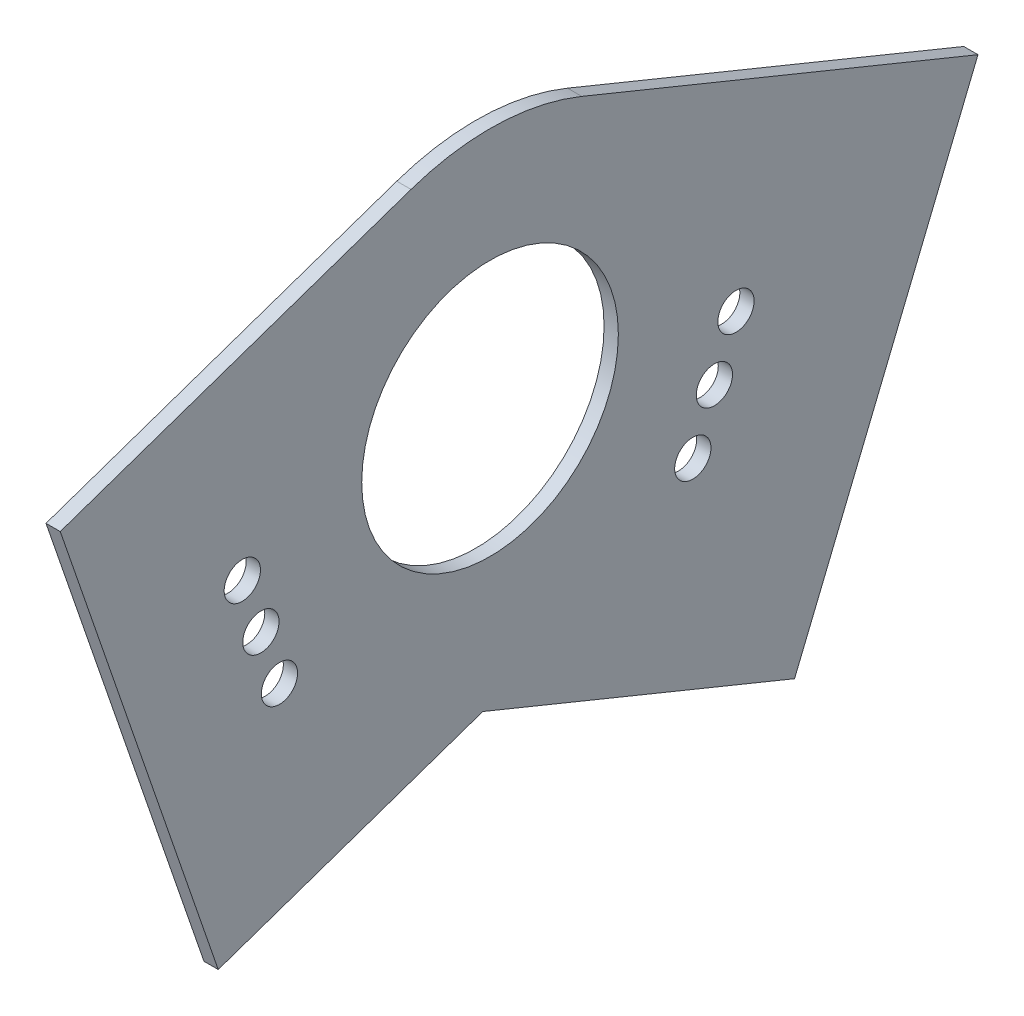
from build123d import *

# Parameters (mm, degrees)
SKETCH1_R           = 2.0193
SKETCH1_R_2         = 14.2875
BOSS_EXTRUDE1_DEPTH = 1.5875


with BuildPart() as part:
    # Sketch1 → Boss-Extrude1 (new body)
    with BuildSketch(Plane(origin=(0, 0, 0), x_dir=(0, 0, -1), z_dir=(1, 0, 0))):
        with BuildLine():
            Line((288.401681083, 160.383356591), (249.345231223, 146.9200509))
            Line((249.345231223, 146.9200509), (266.935398847, 95.891758474))
            Line((266.935398847, 95.891758474), (296.387053498, 106.044156633))
            Line((296.387053498, 106.044156633), (331.100032982, 91.851270852))
            Line((331.100032982, 91.851270852), (351.527026912, 141.811640586))
            Line((351.527026912, 141.811640586), (307.41026186, 159.849395245))
            ThreePointArc((307.41026186, 159.849395245), (297.954559489, 161.846069046), (288.401681083, 160.383356591))
        make_face()
        with Locations((269.613187196, 132.077455087)):
            Circle(SKETCH1_R, mode=Mode.SUBTRACT)
        with Locations((271.682618681, 126.074126566)):
            Circle(SKETCH1_R, mode=Mode.SUBTRACT)
        with Locations((273.752050167, 120.070798045)):
            Circle(SKETCH1_R, mode=Mode.SUBTRACT)
        with Locations((297.196764895, 134.869210378)):
            Circle(SKETCH1_R_2, mode=Mode.SUBTRACT)
        with Locations((324.580125518, 130.53340397)):
            Circle(SKETCH1_R, mode=Mode.SUBTRACT)
        with Locations((322.176949762, 124.655713413)):
            Circle(SKETCH1_R, mode=Mode.SUBTRACT)
        with Locations((319.773774005, 118.778022856)):
            Circle(SKETCH1_R, mode=Mode.SUBTRACT)
    extrude(amount=-BOSS_EXTRUDE1_DEPTH)


solid = part.part
